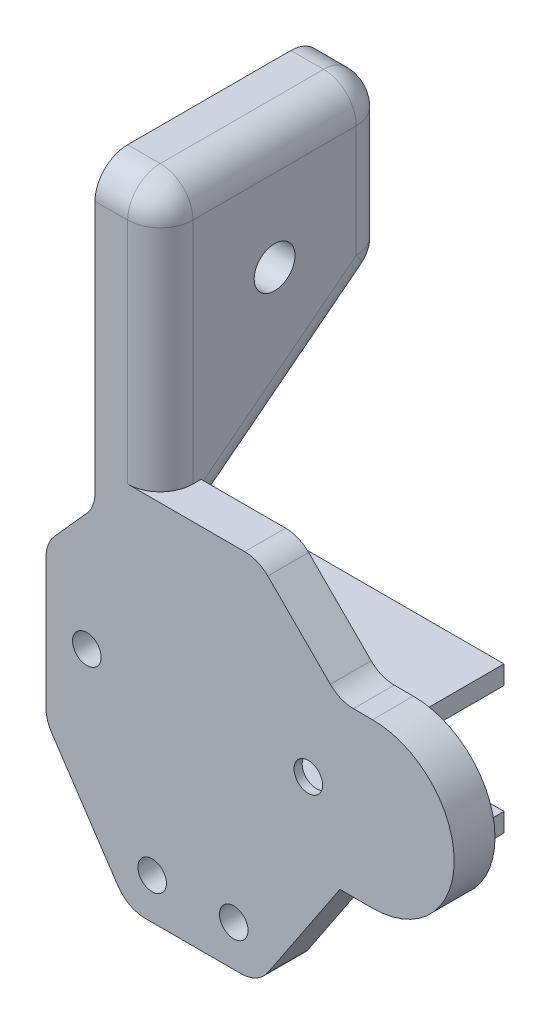
from build123d import *

# Parameters (mm, degrees)
SKETCH2_R           = 1.7500000000000018
SKETCH2_R_2         = 1.7499999999999967
SKETCH2_R_3         = 1.7500000000000013
SKETCH2_R_4         = 1.7500000000000038
BOSS_EXTRUDE2_DEPTH = 5
SKETCH5_W           = 31.39999999999999
SKETCH5_H           = 2.3000000000000007
BOSS_EXTRUDE4_DEPTH = 10
CUT_EXTRUDE1_DEPTH  = 77.48529270389177
FILLET1_RADIUS      = 10
FILLET1_LENGTH      = 5
SKETCH7_W           = 31.39999999999999
SKETCH7_H           = 13.340000000000003
CUT_EXTRUDE3_DEPTH  = 4
SKETCH8_W           = 8
SKETCH8_H           = 28
BOSS_EXTRUDE5_DEPTH = 32
BOSS_EXTRUDE6_DEPTH = 8
SKETCH10_R          = 2.500000000000001
CUT_EXTRUDE4_DEPTH  = 92.61877536837086
CUT_EXTRUDE5_DEPTH  = 89.05679985100527
FILLET3_R           = 4
FILLET2_R           = 4
FILLET4_R           = 4
SCALE1_SCALE        = 1.5


with BuildPart() as part:
    # Sketch2 → Boss-Extrude2 (new body)
    with BuildSketch(Plane.XY):
        Polygon((25.999999999999996, 45), (9.999999999999998, 45), (0, 33.819660112501055), (0, 15.000000000000002), (10.000000000000002, 0), (26, 0), (36.00000000000001, 14.999999999999993), (60, 14.999999999999996), (60, 35), (36.00000000000001, 35), align=None)
        with Locations((12.999999999999998, 5.000000000000004)):
            Circle(SKETCH2_R, mode=Mode.SUBTRACT)
        with Locations((22.999999999999993, 5.000000000000004)):
            Circle(SKETCH2_R_2, mode=Mode.SUBTRACT)
        with Locations((5.000000000000001, 24.999999999999993)):
            Circle(SKETCH2_R_3, mode=Mode.SUBTRACT)
        with Locations((32.129999999999995, 24.999999999999993)):
            Circle(SKETCH2_R_4, mode=Mode.SUBTRACT)
    extrude(amount=BOSS_EXTRUDE2_DEPTH)

    # Sketch5 → Boss-Extrude4 (add)
    with BuildSketch(Plane(origin=(0, 0, 0), x_dir=(-1, 0, 0), z_dir=(0, 0, -1))):
        with Locations((-25.4, 17.179999999999993)):
            Rectangle(SKETCH5_W, SKETCH5_H)
        with Locations((-25.4, 32.82)):
            Rectangle(SKETCH5_W, SKETCH5_H)
    extrude(amount=BOSS_EXTRUDE4_DEPTH)

    # Sketch6 → Cut-Extrude1 (cut, through all)
    with BuildSketch(Plane.XY.offset(5)):
        Polygon((60, 35), (49.999999999999986, 35), (49.99999999999999, 14.999999999999993), (60, 14.999999999999993), align=None)
    extrude(amount=-CUT_EXTRUDE1_DEPTH, mode=Mode.SUBTRACT)

    # Fillet1: full round fillet: the end face becomes a half cylinder, R = half its width
    fillet1_face = Plane((50, 25, 2.5), x_dir=(0, 0, -1), z_dir=(1, 0, 0))  # on the end face: x along it, z out of the body
    fillet1_slab = fillet1_face.offset(-FILLET1_RADIUS / 2) * Box(FILLET1_LENGTH, 2 * FILLET1_RADIUS, FILLET1_RADIUS, mode=Mode.PRIVATE)  # the body's end, R deep
    fillet1_round = Plane((40, 25, 2.5), x_dir=(1, 0, 0), z_dir=(0, 0, -1)) * Cylinder(FILLET1_RADIUS, FILLET1_LENGTH, mode=Mode.PRIVATE)  # its axis R under the face
    add(fillet1_slab - fillet1_round, mode=Mode.SUBTRACT)

    # Sketch7 → Cut-Extrude3 (cut)
    with BuildSketch(Plane(origin=(0, 0, 0), x_dir=(-1, 0, 0), z_dir=(0, 0, -1))):
        with Locations((-25.4, 24.999999999999996)):
            Rectangle(SKETCH7_W, SKETCH7_H)
    extrude(amount=-CUT_EXTRUDE3_DEPTH, mode=Mode.SUBTRACT)

    # Sketch8 → Boss-Extrude5 (add)
    with BuildSketch(Plane(origin=(0, 45, 0), x_dir=(1, 0, 0), z_dir=(0, 1, 0))):
        with Locations((9.999999999999996, 9)):
            Rectangle(SKETCH8_W, SKETCH8_H)
    extrude(amount=BOSS_EXTRUDE5_DEPTH)

    # Sketch9 → Boss-Extrude6 (add)
    with BuildSketch(Plane.ZY.offset(-5.999999999999995)):
        Polygon((5.000000000000001, 45), (-23, 45), (-15.299548194431079, 39.40983005625053), (5, 39.40983005625053), align=None)
    extrude(amount=-BOSS_EXTRUDE6_DEPTH)

    # Sketch10 → Cut-Extrude4 (cut, through all)
    with BuildSketch(Plane.ZY.offset(-5.999999999999995)):
        with Locations((-9, 63)):
            Circle(SKETCH10_R)
    extrude(amount=-CUT_EXTRUDE4_DEPTH, mode=Mode.SUBTRACT)

    # Sketch11 → Cut-Extrude5 (cut, through all)
    with BuildSketch(Plane(origin=(13.999999999999995, 0, 0), x_dir=(0, 0, -1), z_dir=(1, 0, 0))):
        Polygon((0, 39.40983005625053), (23, 57.30500139086019), (23, 45), (15.299548194431079, 39.40983005625053), align=None)
    extrude(amount=-CUT_EXTRUDE5_DEPTH, mode=Mode.SUBTRACT)

    # Fillet3
    fillet3_edges = [part.edges().sort_by_distance(p)[0] for p in [
        (9.999999999999995, 77, -23),
        (9.999999999999995, 77, 5.000000000000001),
        (9.999999999999995, 39.40983005625053, 0),
        (9.999999999999995, 57.30500139086019, -23),
    ]]
    fillet(fillet3_edges, radius=FILLET3_R)

    # Fillet2
    # the kernel refuses this fillet: 4 mm, written as the material it takes off along each edge
    with BuildSketch(Plane(origin=(13.999999999999995, 40.61090749308988, -1.5437002826498933), x_dir=(-1, 1.3e-16, 1e-16), z_dir=(0, 0.6140749293375269, -0.7892477311713423))) as fillet2_piece_1_section:
        with BuildLine():
            CenterArc((FILLET2_R, FILLET2_R), FILLET2_R, 180, 90)
            Line((6.8e-16, FILLET2_R), (0, 0))
            Line((0, 0), (FILLET2_R, 0))
        make_face()
    fillet2_piece_1 = extrude(amount=25.229846914032212, mode=Mode.PRIVATE)
    fillet2_piece_1 = split(fillet2_piece_1, bisect_by=Plane(origin=(13.08677452715668, 48.37488686948177, 0), z_dir=(0, 0, -1)), keep=Keep.TOP, mode=Mode.PRIVATE)
    add(fillet2_piece_1, mode=Mode.SUBTRACT)
    with BuildSketch(Plane(origin=(13.999999999999995, 59.26091487870621, -23), x_dir=(-1, 0, 0), z_dir=(0, 1, 0))) as fillet2_piece_2:
        with BuildLine():
            CenterArc((FILLET2_R, FILLET2_R), FILLET2_R, 180, 90)
            Line((0, FILLET2_R), (0, 0))
            Line((0, 0), (FILLET2_R, 0))
        make_face()
    extrude(amount=13.73908512129379, mode=Mode.SUBTRACT)
    with BuildSketch(Plane(origin=(13.999999999999995, 77, -19), x_dir=(-1, 0, 0), z_dir=(0, 0, 1))) as fillet2_piece_3:
        with BuildLine():
            CenterArc((FILLET2_R, FILLET2_R), FILLET2_R, 180, 90)
            Line((0, FILLET2_R), (0, 0))
            Line((0, 0), (FILLET2_R, 0))
        make_face()
    extrude(amount=20, mode=Mode.SUBTRACT)
    with BuildSketch(Plane(origin=(13.999999999999995, 45, 5.000000000000001), x_dir=(-1, 0, -2.2e-16), z_dir=(0, 1, 0))) as fillet2_piece_4:
        with BuildLine():
            CenterArc((FILLET2_R, -FILLET2_R), FILLET2_R, 90.00000000000001, 89.99999999999999)
            Line((2.66e-15, -FILLET2_R), (0, 0))
            Line((0, 0), (FILLET2_R, 0))
        make_face()
    extrude(amount=28, mode=Mode.SUBTRACT)
    with BuildSketch(Plane(origin=(13.999999999999995, 73, 1.0000000000000009), x_dir=(0, 0, 1), z_dir=(0, -1, 0))) as fillet2_piece_5:
        with BuildLine():
            CenterArc((4 - FILLET2_R, FILLET2_R), FILLET2_R, 270, 90)
            Line((4 - FILLET2_R, 0), (4, 0))
            Line((4, 0), (4, FILLET2_R))
        make_face()
    revolve(axis=Axis((13.999999999999995, 73, 1.0000000000000009), (-1, 0, 0)), revolution_arc=90, mode=Mode.SUBTRACT)
    with BuildSketch(Plane(origin=(13.999999999999995, 73, -19), x_dir=(0, 0, -1), z_dir=(0, -1, 0))) as fillet2_piece_6:
        with BuildLine():
            CenterArc((4 - FILLET2_R, -FILLET2_R), FILLET2_R, 0, 90)
            Line((4 - FILLET2_R, 0), (4, 0))
            Line((4, 0), (4, -FILLET2_R))
        make_face()
    revolve(axis=Axis((13.999999999999995, 73, -19), (1, 0, 0)), revolution_arc=90, mode=Mode.SUBTRACT)
    with BuildSketch(Plane(origin=(13.999999999999995, 59.26091487870621, -19), x_dir=(0, 0, -1), z_dir=(0, 1, 0))) as fillet2_piece_7:
        with BuildLine():
            CenterArc((4 - FILLET2_R, FILLET2_R), FILLET2_R, 270, 90)
            Line((4 - FILLET2_R, 0), (4, 0))
            Line((4, 0), (4, FILLET2_R))
        make_face()
    revolve(axis=Axis((13.999999999999995, 59.26091487870621, -19), (-1, 0, 0)), revolution_arc=52.11526627923318, mode=Mode.SUBTRACT)
    with BuildSketch(Plane(origin=(13.999999999999995, 37.453916568404516, -4.000000000000001), x_dir=(0, 0.7892477311713422, 0.614074929337527), z_dir=(0, 0.614074929337527, -0.7892477311713422))) as fillet2_piece_8_section:
        with BuildLine():
            CenterArc((3.999999999999998 + FILLET2_R, -FILLET2_R), FILLET2_R, 90.00000000000004, 89.99999999999994)
            Line((3.999999999999998 + FILLET2_R, 0), (3.999999999999998, 0))
            Line((3.999999999999998, 0), (4, -FILLET2_R))
        make_face()
    fillet2_piece_8 = revolve(axis=Axis((13.999999999999995, 37.453916568404516, -4.000000000000001), (1, 0, 0)), revolution_arc=195.37400527524528, mode=Mode.PRIVATE)
    fillet2_piece_8 = split(fillet2_piece_8, bisect_by=Plane(origin=(12.442859007716585, 39.2454758765285, 0), z_dir=(0, 0, -1)), keep=Keep.TOP, mode=Mode.PRIVATE)
    fillet2_piece_8 = split(fillet2_piece_8, bisect_by=Plane(origin=(12.442859007716585, 33.97, -0.3361174942439581), z_dir=(0, 1, 0)), keep=Keep.TOP, mode=Mode.PRIVATE)
    add(fillet2_piece_8, mode=Mode.SUBTRACT)

    # Fillet4
    fillet4_edges = [part.edges().sort_by_distance(p)[0] for p in [
        (5.999999999999995, 40.52786404500041, 2.500000000000001),
        (26, 0, 2.5),
        (10.000000000000002, 0, 2.5),
        (0, 15.000000000000002, 2.5),
        (0, 33.819660112501055, 2.5),
        (25.999999999999996, 45, 2.5),
        (36.00000000000001, 35, 2.5),
    ]]
    fillet(fillet4_edges, radius=FILLET4_R)


with BuildPart() as part_1:
    # Scale1: scaled about (16.416357699, 40.343462641, -2.727678487)
    add(part.part.scale(SCALE1_SCALE).moved(Location((-8.2081788495, -20.1717313205, 1.3638392435))))


solid = part_1.part
